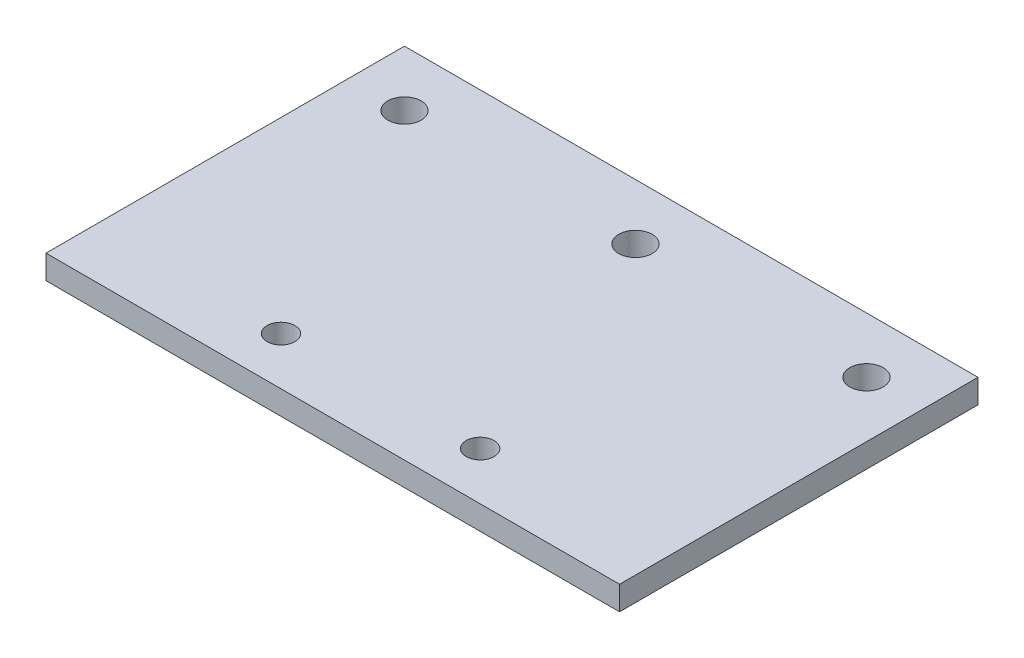
from build123d import *

# Parameters (mm, degrees)
SKETCH1_W           = 72
SKETCH1_H           = 45
SKETCH1_R           = 2.1
SKETCH1_R_2         = 1.75
BOSS_EXTRUDE1_DEPTH = 3
CUT_EXTRUDE2_DEPTH  = 0.5


with BuildPart() as part:
    # Sketch1 → Boss-Extrude1 (new body)
    with BuildSketch(Plane(origin=(0, 0, 0), x_dir=(1, 0, 0), z_dir=(0, 1, 0))):
        with Locations((36, -22.5)):
            Rectangle(SKETCH1_W, SKETCH1_H)
        with Locations((7, -7)):
            Circle(SKETCH1_R, mode=Mode.SUBTRACT)
        with Locations((36, -7)):
            Circle(SKETCH1_R, mode=Mode.SUBTRACT)
        with Locations((65, -7)):
            Circle(SKETCH1_R, mode=Mode.SUBTRACT)
        with Locations((23.5, -39)):
            Circle(SKETCH1_R_2, mode=Mode.SUBTRACT)
        with Locations((48.5, -39)):
            Circle(SKETCH1_R_2, mode=Mode.SUBTRACT)
    extrude(amount=BOSS_EXTRUDE1_DEPTH)

    # Sketch2 → Cut-Extrude2 (cut)
    # profile 1 of 6: a face of its own
    with BuildSketch(Plane.XZ):
        with BuildLine():
            Line((4.423494036, 26.43482906), (4.423494036, 26.244871795))
            Line((4.423494036, 26.244871795), (3.195980013, 26.244871795))
            add(Edge.make_bspline(
                [(3.195980013, 26.244871795), (3.169831563, 26.24503934), (3.119358756, 26.245362741), (3.04637713, 26.247691662), (2.978966688, 26.252602738), (2.916819988, 26.258171798), (2.860225093, 26.266182907), (2.809013126, 26.275965758), (2.763134944, 26.286994002), (2.73487754, 26.296682419), (2.721510863, 26.301265358)],
                knots=[0, 0, 0, 0, 1.307562039, 2.523909702, 3.650326591, 4.686913197, 5.643429486, 6.506965704, 7.293745905, 8, 8, 8, 8], degree=3))
            add(Edge.make_bspline(
                [(2.721510863, 26.301265358), (2.704135496, 26.308031528), (2.669904274, 26.321361564), (2.621390296, 26.346338949), (2.575670537, 26.374264588), (2.533267405, 26.40627237), (2.493513748, 26.441552541), (2.457103748, 26.480752946), (2.42347232, 26.523176569), (2.393284851, 26.569168648), (2.366832646, 26.618263256), (2.343419515, 26.669807439), (2.323198421, 26.723652189), (2.308020893, 26.780315425), (2.294878894, 26.838936442), (2.286324075, 26.900196905), (2.280502177, 26.963741031), (2.279963773, 27.006948461), (2.279690617, 27.028869525)],
                knots=[0, 0, 0, 0, 0.981884813, 1.934411902, 2.870642727, 3.801527012, 4.729816098, 5.667674509, 6.616731011, 7.579249157, 8.562291171, 9.552107921, 10.560574871, 11.588648803, 12.640348669, 13.724070705, 14.845319185, 16, 16, 16, 16], degree=3))
            add(Edge.make_bspline(
                [(2.279690617, 27.028869525), (2.280207439, 27.060852515), (2.281216931, 27.123323889), (2.293020302, 27.214399619), (2.309601389, 27.30078468), (2.334962347, 27.38138587), (2.365868894, 27.455891705), (2.401070851, 27.523967839), (2.441841664, 27.584494611), (2.488089085, 27.639007164), (2.543105256, 27.688196898), (2.607933583, 27.734478461), (2.683569716, 27.779025557), (2.739082386, 27.805132339), (2.768152155, 27.818803419)],
                knots=[0, 0, 0, 0, 1.157931887, 2.261752077, 3.322178827, 4.340878186, 5.316509817, 6.24181319, 7.112369066, 7.954886437, 8.824930176, 9.778504873, 10.836691706, 12, 12, 12, 12], degree=3))
            Line((2.768152155, 27.818803419), (2.768152155, 27.628846154))
            add(Edge.make_bspline(
                [(2.768152155, 27.628846154), (2.74389765, 27.613568532), (2.696483077, 27.583702663), (2.635091788, 27.527853819), (2.582626658, 27.466648089), (2.540347285, 27.398019899), (2.508470411, 27.321683698), (2.485746303, 27.237593559), (2.472141418, 27.145065216), (2.470501731, 27.080647058), (2.469647882, 27.04710203)],
                knots=[0, 0, 0, 0, 0.997731894, 1.950442991, 2.880492273, 3.800895997, 4.748200782, 5.754801363, 6.83083817, 8, 8, 8, 8], degree=3))
            add(Edge.make_bspline(
                [(2.469647882, 27.04710203), (2.470508849, 27.013980238), (2.472168709, 26.95012474), (2.485813508, 26.858179397), (2.508413348, 26.774195538), (2.540173207, 26.698803972), (2.579398849, 26.633143604), (2.622797316, 26.576343526), (2.67190961, 26.530304396), (2.717130879, 26.499330394), (2.757423153, 26.480078352), (2.792107694, 26.467818401), (2.831328282, 26.457855595), (2.874953216, 26.449522067), (2.923044888, 26.442645374), (2.97571324, 26.438289345), (3.03283858, 26.435141068), (3.072446335, 26.434935468), (3.092945158, 26.43482906)],
                knots=[0, 0, 0, 0, 1.570672572, 3.028099501, 4.397683431, 5.686589315, 6.895122698, 8.017723291, 9.066023084, 10.075791025, 10.603605416, 11.180458235, 11.81795017, 12.521450677, 13.286658401, 14.121327423, 15.027701111, 16, 16, 16, 16], degree=3))
            Line((3.092945158, 26.43482906), (3.173083379, 26.43482906))
            add(Edge.make_bspline(
                [(3.173083379, 26.43482906), (3.150137622, 26.454109545), (3.104649718, 26.492331378), (3.045043395, 26.558339523), (2.993707497, 26.630437372), (2.951604799, 26.708502181), (2.917930794, 26.790621737), (2.894379575, 26.87590661), (2.879163826, 26.963592281), (2.877526545, 27.023011439), (2.876699164, 27.053038194)],
                knots=[0, 0, 0, 0, 1.012485704, 2.007162095, 2.997754123, 3.998611389, 4.999708251, 5.992315798, 6.98544096, 8, 8, 8, 8], degree=3))
            add(Edge.make_bspline(
                [(2.876699164, 27.053038194), (2.877010632, 27.070719176), (2.877629883, 27.105871904), (2.883047811, 27.158095966), (2.890908955, 27.209549373), (2.902448682, 27.260112127), (2.917260345, 27.309857189), (2.935776183, 27.358702351), (2.956710085, 27.407043107), (2.981367935, 27.454000732), (3.008801287, 27.499107654), (3.038518773, 27.542023227), (3.070363926, 27.582524191), (3.104654189, 27.620219451), (3.141327356, 27.65508023), (3.180039057, 27.687498571), (3.221093814, 27.717181402), (3.264507607, 27.743744025), (3.309221958, 27.768011612), (3.355451046, 27.788789068), (3.402902409, 27.806037029), (3.450982831, 27.821237785), (3.500569077, 27.832001799), (3.551073449, 27.840232592), (3.602804063, 27.844850599), (3.63765057, 27.845575442), (3.655184741, 27.845940171)],
                knots=[0, 0, 0, 0, 1.028796061, 2.045417375, 3.052978994, 4.056772505, 5.061374657, 6.071351207, 7.095367434, 8.125609542, 9.155490328, 10.16637099, 11.162041966, 12.151987513, 13.129482149, 14.104793677, 15.088808581, 16.075021637, 17.065069715, 18.0481558, 19.021557435, 20.00254184, 20.980451754, 21.971763498, 22.979425854, 24, 24, 24, 24], degree=3))
            add(Edge.make_bspline(
                [(3.655184741, 27.845940171), (3.672724792, 27.845626419), (3.70773696, 27.845000129), (3.759672295, 27.839583657), (3.810918083, 27.831874116), (3.860918314, 27.81960799), (3.910394816, 27.805053392), (3.95854208, 27.786176677), (4.005997289, 27.764428294), (4.05234429, 27.73957093), (4.097156688, 27.711745771), (4.139516677, 27.681117771), (4.179776603, 27.648327207), (4.217420095, 27.61271418), (4.252729303, 27.574489206), (4.285394387, 27.533541168), (4.316005776, 27.490325511), (4.343891623, 27.444694218), (4.368555315, 27.397355209), (4.391060038, 27.34951014), (4.408921158, 27.300525505), (4.424658935, 27.25131449), (4.435807839, 27.201010447), (4.444408909, 27.150230166), (4.449649002, 27.0987998), (4.450303104, 27.064356859), (4.450630788, 27.04710203)],
                knots=[0, 0, 0, 0, 1.008914434, 2.013921196, 3.001938835, 3.98818112, 4.973517748, 5.967241793, 6.960633033, 7.975722852, 8.991170928, 9.993245185, 10.981396684, 11.976616977, 12.972235889, 13.973022409, 14.988340224, 16.01763096, 17.047082309, 18.058647952, 19.057085865, 20.044802253, 21.029198803, 22.0185208, 23.007341325, 24, 24, 24, 24], degree=3))
            add(Edge.make_bspline(
                [(4.450630788, 27.04710203), (4.449823108, 27.018645117), (4.448232158, 26.962591299), (4.435361307, 26.879935529), (4.415300669, 26.800090162), (4.386138751, 26.722646176), (4.346674616, 26.647130861), (4.294024708, 26.573998697), (4.229229, 26.501997715), (4.179039947, 26.457788746), (4.152974538, 26.43482906)],
                knots=[0, 0, 0, 0, 0.967343326, 1.905452219, 2.838102277, 3.762990896, 4.713322225, 5.726933809, 6.819495538, 8, 8, 8, 8], degree=3))
            Line((4.152974538, 26.43482906), (4.423494036, 26.43482906))
        make_face()
        with BuildLine():
            add(Edge.make_bspline(
                [(4.260673523, 27.031837607), (4.259729458, 27.059614759), (4.257860411, 27.114607629), (4.24190382, 27.195215169), (4.216899853, 27.273034726), (4.181130914, 27.346574594), (4.137537484, 27.415470369), (4.084693971, 27.476563367), (4.024517712, 27.530098824), (3.956981813, 27.574824031), (3.884453534, 27.610761637), (3.808102585, 27.636889221), (3.728808707, 27.653214814), (3.674766665, 27.655055823), (3.647552529, 27.655982906)],
                knots=[0, 0, 0, 0, 1.026331696, 2.03191913, 3.02692423, 4.041490544, 5.047661868, 6.033509946, 7.018359977, 8.017132933, 9.01989117, 10.003339456, 10.994534818, 12, 12, 12, 12], degree=3))
            add(Edge.make_bspline(
                [(3.647552529, 27.655982906), (3.627030855, 27.655544196), (3.586670724, 27.654681382), (3.527443377, 27.64637903), (3.47102458, 27.632975232), (3.417448646, 27.6139257), (3.366202273, 27.590476699), (3.318232977, 27.560273564), (3.272660616, 27.525512831), (3.230421767, 27.485640303), (3.191893907, 27.441771648), (3.158217236, 27.394220074), (3.130295068, 27.343246005), (3.106520921, 27.28966394), (3.089031591, 27.232339481), (3.07571021, 27.172132208), (3.068083023, 27.108638276), (3.067138165, 27.065354269), (3.066656429, 27.043285924)],
                knots=[0, 0, 0, 0, 1.039892369, 2.045164194, 3.025377528, 3.974939947, 4.923826224, 5.876304068, 6.842270891, 7.825700405, 8.815919897, 9.798017152, 10.773083594, 11.758208475, 12.764450271, 13.80592145, 14.881349344, 16, 16, 16, 16], degree=3))
            add(Edge.make_bspline(
                [(3.066656429, 27.043285924), (3.06712065, 27.020931651), (3.068028428, 26.977218107), (3.075831973, 26.913372829), (3.088424309, 26.852876832), (3.10630291, 26.795785623), (3.129115553, 26.741883512), (3.157984968, 26.691776495), (3.19086203, 26.644388392), (3.229212979, 26.601238898), (3.271470152, 26.562201738), (3.317483561, 26.528252265), (3.366365202, 26.499095046), (3.41873829, 26.475888849), (3.47391075, 26.456746469), (3.5328129, 26.444678359), (3.594577806, 26.436023084), (3.636919542, 26.435233118), (3.658576835, 26.43482906)],
                knots=[0, 0, 0, 0, 1.121992135, 2.194043731, 3.223932285, 4.220423016, 5.193184374, 6.156086365, 7.118779155, 8.084057622, 9.048292205, 10.002025119, 10.950065319, 11.899697616, 12.87359713, 13.875731462, 14.913461982, 16, 16, 16, 16], degree=3))
            add(Edge.make_bspline(
                [(3.658576835, 26.43482906), (3.686769537, 26.435639179), (3.741848171, 26.437221869), (3.822104163, 26.452157771), (3.897559526, 26.47623951), (3.967975487, 26.510013524), (4.032606422, 26.552335882), (4.090253534, 26.603312126), (4.140997801, 26.662061024), (4.183253261, 26.728421865), (4.217520616, 26.799914417), (4.242890164, 26.874690228), (4.257595363, 26.952538428), (4.259639756, 27.005205832), (4.260673523, 27.031837607)],
                knots=[0, 0, 0, 0, 1.070930318, 2.092221514, 3.091405799, 4.074392322, 5.052047932, 6.019043127, 6.99061078, 7.993717296, 9.000730765, 9.998165278, 10.987753177, 12, 12, 12, 12], degree=3))
        make_face(mode=Mode.SUBTRACT)
    # profile 2 of 6: a face of its own
    with BuildSketch(Plane.XZ):
        with BuildLine():
            Line((4.423494036, 25.864957265), (4.423494036, 25.675))
            Line((4.423494036, 25.675), (4.195799725, 25.675))
            add(Edge.make_bspline(
                [(4.195799725, 25.675), (4.217002372, 25.660978007), (4.257552271, 25.634161054), (4.311147307, 25.589560422), (4.355720437, 25.543889685), (4.390836421, 25.496580868), (4.417350585, 25.448029456), (4.436934526, 25.399042786), (4.448318183, 25.348606082), (4.449858887, 25.314644483), (4.450630788, 25.297629541)],
                knots=[0, 0, 0, 0, 1.280622107, 2.44917983, 3.507334186, 4.490567186, 5.408878616, 6.288712897, 7.142636019, 8, 8, 8, 8], degree=3))
            add(Edge.make_bspline(
                [(4.450630788, 25.297629541), (4.44992691, 25.284425533), (4.448485966, 25.257394953), (4.43785522, 25.216352112), (4.421526665, 25.173891045), (4.405795891, 25.146490071), (4.397629319, 25.132264957)],
                knots=[0, 0, 0, 0, 0.90119973, 1.844890732, 2.881183062, 4, 4, 4, 4], degree=3))
            Line((4.397629319, 25.132264957), (4.233112759, 25.236571848))
            add(Edge.make_bspline(
                [(4.233112759, 25.236571848), (4.237189015, 25.245709209), (4.24492653, 25.263053668), (4.254083841, 25.288426191), (4.259475847, 25.31181919), (4.260292709, 25.326722676), (4.260673523, 25.33367054)],
                knots=[0, 0, 0, 0, 1.180555205, 2.24091978, 3.179933427, 4, 4, 4, 4], degree=3))
            add(Edge.make_bspline(
                [(4.260673523, 25.33367054), (4.259694858, 25.349067185), (4.257716496, 25.380191374), (4.241055141, 25.425820811), (4.215267885, 25.47029855), (4.185650966, 25.505172121), (4.157638478, 25.532381074), (4.133042781, 25.551808381), (4.105482287, 25.569641234), (4.075406583, 25.586676692), (4.042308374, 25.602198928), (4.00651653, 25.61668573), (3.967990121, 25.629784205), (3.94114926, 25.63725316), (3.927400286, 25.64107906)],
                knots=[0, 0, 0, 0, 1.135927944, 2.296268816, 3.551388088, 4.924624343, 5.663947748, 6.437790805, 7.238014523, 8.089896346, 8.992356783, 9.939655789, 10.944608424, 12, 12, 12, 12], degree=3))
            add(Edge.make_bspline(
                [(3.927400286, 25.64107906), (3.915137424, 25.643941031), (3.887976116, 25.65028008), (3.842408199, 25.656443534), (3.788570081, 25.662533195), (3.726311904, 25.666824959), (3.65578914, 25.670803108), (3.576894354, 25.673046825), (3.489546565, 25.674923486), (3.428481123, 25.674973722), (3.396537572, 25.675)],
                knots=[0, 0, 0, 0, 0.566838948, 1.255505196, 2.06880316, 3.007127437, 4.065329342, 5.249902469, 6.561414163, 8, 8, 8, 8], degree=3))
            Line((3.396537572, 25.675), (2.876699164, 25.675))
            Line((2.876699164, 25.675), (2.876699164, 25.864957265))
            Line((2.876699164, 25.864957265), (4.423494036, 25.864957265))
        make_face()
    # profile 3 of 6: a face of its own
    with BuildSketch(Plane.XZ):
        with BuildLine():
            add(Edge.make_bspline(
                [(4.450630788, 24.168062233), (4.450014601, 24.139038219), (4.448806408, 24.08212922), (4.435829771, 23.998798463), (4.416151529, 23.919336542), (4.388451844, 23.84340259), (4.352108775, 23.771624734), (4.30815919, 23.703362115), (4.256305745, 23.638751501), (4.216171534, 23.600034427), (4.195799725, 23.580381944)],
                knots=[0, 0, 0, 0, 1.054042676, 2.066720093, 3.05716247, 4.025731183, 4.997454851, 5.974904663, 6.97207755, 8, 8, 8, 8], degree=3))
            add(Edge.make_bspline(
                [(4.195799725, 23.580381944), (4.176317933, 23.563459525), (4.137731377, 23.52994218), (4.075165363, 23.486964341), (4.010371112, 23.449939874), (3.942488205, 23.420268464), (3.872109237, 23.396873235), (3.798992307, 23.380263028), (3.723298887, 23.370383073), (3.671891804, 23.369050802), (3.645856482, 23.368376068)],
                knots=[0, 0, 0, 0, 1.025258237, 2.030674902, 3.01204498, 3.988269485, 4.97094183, 5.956517959, 6.965070386, 8, 8, 8, 8], degree=3))
            add(Edge.make_bspline(
                [(3.645856482, 23.368376068), (3.619670257, 23.368969544), (3.567925054, 23.370142279), (3.491713343, 23.3812358), (3.417814567, 23.398490312), (3.346538127, 23.423183856), (3.277666101, 23.454848032), (3.21149949, 23.493486739), (3.147907038, 23.5393708), (3.087431471, 23.591383527), (3.031686383, 23.64886435), (2.983130344, 23.711235681), (2.941355497, 23.777317034), (2.908174654, 23.848010484), (2.881428583, 23.922309733), (2.862985445, 24.000687371), (2.851734631, 24.083073478), (2.85029667, 24.139334149), (2.849562412, 24.168062233)],
                knots=[0, 0, 0, 0, 0.998669827, 1.973418153, 2.932281609, 3.89081133, 4.846438734, 5.82045571, 6.809776312, 7.834649874, 8.860672198, 9.859676908, 10.845817165, 11.837296335, 12.833502054, 13.853824644, 14.904110009, 16, 16, 16, 16], degree=3))
            add(Edge.make_bspline(
                [(2.849562412, 24.168062233), (2.850302745, 24.196929686), (2.851752726, 24.253468052), (2.862901755, 24.336164376), (2.88162564, 24.414872008), (2.907843543, 24.48952271), (2.941628034, 24.560215874), (2.982967802, 24.626541233), (3.031710971, 24.688941984), (3.087424809, 24.746440828), (3.147908754, 24.798448723), (3.211499045, 24.844334031), (3.277666217, 24.882972413), (3.346538096, 24.914636674), (3.417814576, 24.939330196), (3.491713341, 24.956584715), (3.567925055, 24.967678234), (3.619670257, 24.968850969), (3.645856482, 24.969444444)],
                knots=[0, 0, 0, 0, 1.099861214, 2.154133753, 3.1731438, 4.178222029, 5.163564916, 6.153006591, 7.15072618, 8.175428628, 9.198983792, 10.187031731, 11.15979573, 12.114193814, 13.071490482, 14.029120454, 15.002614863, 16, 16, 16, 16], degree=3))
            add(Edge.make_bspline(
                [(3.645856482, 24.969444444), (3.671750298, 24.968765109), (3.723015603, 24.967420142), (3.798566731, 24.95755012), (3.871559914, 24.941004707), (3.941667225, 24.917581434), (4.009252656, 24.887636533), (4.074207006, 24.851132325), (4.136490104, 24.807716086), (4.175026791, 24.774332048), (4.19452769, 24.757438568)],
                knots=[0, 0, 0, 0, 1.031353054, 2.041901799, 3.029428768, 4.008703097, 4.981709435, 5.96992636, 6.972712378, 8, 8, 8, 8], degree=3))
            add(Edge.make_bspline(
                [(4.19452769, 24.757438568), (4.215072737, 24.737814088), (4.255478187, 24.699219095), (4.307229322, 24.634310229), (4.351771454, 24.566341252), (4.388096233, 24.494100404), (4.41610127, 24.417955312), (4.435921615, 24.337902814), (4.448749009, 24.25426875), (4.449997277, 24.197084113), (4.450630788, 24.168062233)],
                knots=[0, 0, 0, 0, 1.027951202, 2.021646915, 2.998468564, 3.9668038, 4.943370589, 5.93035926, 6.949632805, 8, 8, 8, 8], degree=3))
        make_face()
        with BuildLine():
            add(Edge.make_bspline(
                [(4.260673523, 24.168910256), (4.260090143, 24.189434408), (4.258938443, 24.229952883), (4.250179585, 24.289594583), (4.236300125, 24.347009542), (4.216588639, 24.402314015), (4.191105406, 24.455294104), (4.159982092, 24.506008101), (4.123052932, 24.554319758), (4.081051926, 24.599857935), (4.035431468, 24.642141314), (3.986375539, 24.678677482), (3.935291457, 24.709802227), (3.881914058, 24.735703799), (3.825737833, 24.755001808), (3.767389598, 24.769015492), (3.706753008, 24.777766671), (3.665531805, 24.778907464), (3.644584447, 24.779487179)],
                knots=[0, 0, 0, 0, 1.021589593, 2.016807015, 2.994807536, 3.958602519, 4.934347097, 5.916793557, 6.916107818, 7.957073844, 8.998039869, 10.008589932, 10.997041759, 11.972786337, 12.956492182, 13.948170289, 14.957322718, 16, 16, 16, 16], degree=3))
            add(Edge.make_bspline(
                [(3.644584447, 24.779487179), (3.61751893, 24.778517998), (3.563798939, 24.776594354), (3.484706943, 24.760872004), (3.408633657, 24.734756449), (3.336495025, 24.698744847), (3.269634043, 24.654395477), (3.209512333, 24.602537983), (3.158448429, 24.54245542), (3.115502826, 24.476193712), (3.081683204, 24.404691873), (3.057430037, 24.329148661), (3.041876275, 24.250251921), (3.040312084, 24.196261441), (3.039519677, 24.168910256)],
                knots=[0, 0, 0, 0, 1.016977094, 2.018509362, 3.018404954, 4.033172147, 5.041280572, 6.028085189, 7.007940189, 7.995502847, 8.989109012, 9.972200833, 10.97273166, 12, 12, 12, 12], degree=3))
            add(Edge.make_bspline(
                [(3.039519677, 24.168910256), (3.040307494, 24.141557498), (3.041862624, 24.087563913), (3.057508838, 24.008557398), (3.081577742, 23.932807147), (3.115541023, 23.861230964), (3.158286106, 23.794939081), (3.209803239, 23.735285548), (3.269475994, 23.682981464), (3.336406372, 23.63858818), (3.408745805, 23.603156825), (3.484692926, 23.576918456), (3.563802509, 23.561233813), (3.617520126, 23.559305079), (3.644584447, 23.558333333)],
                knots=[0, 0, 0, 0, 1.027082318, 2.027431966, 3.015401697, 4.008827937, 4.996211763, 5.971861488, 6.96198607, 7.969911943, 8.982141629, 9.981856156, 10.983207064, 12, 12, 12, 12], degree=3))
            add(Edge.make_bspline(
                [(3.644584447, 23.558333333), (3.665533478, 23.558908736), (3.706757972, 23.56004104), (3.767370622, 23.568853957), (3.825853238, 23.582649953), (3.881687672, 23.602793026), (3.935552156, 23.627805641), (3.986222142, 23.659687532), (4.035462654, 23.696053522), (4.081024429, 23.73841449), (4.123206394, 23.783947541), (4.159847568, 23.832622141), (4.19112318, 23.883359691), (4.216591777, 23.936356523), (4.236224255, 23.991535845), (4.250240046, 24.048776488), (4.258906508, 24.108154067), (4.260080751, 24.148528664), (4.260673523, 24.168910256)],
                knots=[0, 0, 0, 0, 1.043020522, 2.052505155, 3.044509714, 4.030878336, 5.003918577, 5.996372628, 7.007255355, 8.048564058, 9.08987276, 10.095126797, 11.077896669, 12.053962454, 13.01807471, 13.98956039, 14.985105429, 16, 16, 16, 16], degree=3))
        make_face(mode=Mode.SUBTRACT)
    # profile 4 of 6: a face of its own
    with BuildSketch(Plane.XZ):
        with BuildLine():
            Line((4.423494036, 23.015598291), (4.423494036, 22.825641026))
            Line((4.423494036, 22.825641026), (3.706066151, 22.825641026))
            add(Edge.make_bspline(
                [(3.706066151, 22.825641026), (3.685006679, 22.825555207), (3.644720895, 22.82539104), (3.58675133, 22.824277709), (3.533885032, 22.821659033), (3.486091463, 22.818384958), (3.443378707, 22.814174524), (3.405895953, 22.809165063), (3.373218137, 22.803565922), (3.353537155, 22.798085138), (3.344384127, 22.795536191)],
                knots=[0, 0, 0, 0, 1.388932606, 2.656963016, 3.823490214, 4.879454478, 5.816252168, 6.653371382, 7.373723809, 8, 8, 8, 8], degree=3))
            add(Edge.make_bspline(
                [(3.344384127, 22.795536191), (3.332879851, 22.791447094), (3.310110471, 22.783353911), (3.277217607, 22.768674623), (3.246754288, 22.750513178), (3.217535392, 22.730646191), (3.190465168, 22.707705721), (3.16536681, 22.682027198), (3.141947537, 22.654066412), (3.11370202, 22.613109395), (3.08381043, 22.557120646), (3.057659027, 22.483777144), (3.042259735, 22.404107312), (3.040449911, 22.348978666), (3.039519677, 22.320643029)],
                knots=[0, 0, 0, 0, 0.725930277, 1.436768641, 2.137297926, 2.832005607, 3.535753883, 4.242956221, 4.964984144, 5.701683124, 7.198126434, 8.723945959, 10.316137162, 12, 12, 12, 12], degree=3))
            add(Edge.make_bspline(
                [(3.039519677, 22.320643029), (3.040446436, 22.292303801), (3.042235001, 22.237611576), (3.057426528, 22.158774177), (3.082210251, 22.086574605), (3.117290686, 22.021855856), (3.160058292, 21.965024207), (3.210262551, 21.917669872), (3.266292424, 21.87859756), (3.308096282, 21.861537618), (3.329119703, 21.852958066)],
                knots=[0, 0, 0, 0, 1.157091467, 2.233085092, 3.266839029, 4.264239195, 5.228693433, 6.160074799, 7.074690074, 8, 8, 8, 8], degree=3))
            add(Edge.make_bspline(
                [(3.329119703, 21.852958066), (3.337565809, 21.850419679), (3.356238087, 21.844807926), (3.387919055, 21.83882168), (3.425663015, 21.833205974), (3.469866343, 21.82946204), (3.520139239, 21.825189059), (3.576741685, 21.823713588), (3.639340045, 21.821606539), (3.68316688, 21.821589894), (3.706066151, 21.821581197)],
                knots=[0, 0, 0, 0, 0.557560243, 1.232629526, 2.036798082, 2.970922211, 4.03790722, 5.227863888, 6.551574656, 8, 8, 8, 8], degree=3))
            Line((3.706066151, 21.821581197), (4.423494036, 21.821581197))
            Line((4.423494036, 21.821581197), (4.423494036, 21.631623932))
            Line((4.423494036, 21.631623932), (3.670449164, 21.631623932))
            add(Edge.make_bspline(
                [(3.670449164, 21.631623932), (3.644863398, 21.631891051), (3.595223512, 21.6324093), (3.523085032, 21.63573994), (3.455858318, 21.641454675), (3.393507914, 21.650128686), (3.336080991, 21.660328063), (3.28350538, 21.673486557), (3.235938311, 21.689193441), (3.192561081, 21.706928954), (3.153190353, 21.727823028), (3.116045054, 21.750210879), (3.081187023, 21.775336634), (3.048444923, 21.802977767), (3.017937515, 21.833010131), (2.989797796, 21.865634372), (2.963527777, 21.900196099), (2.939641453, 21.937297839), (2.918349132, 21.976977482), (2.899784991, 22.019035386), (2.884449042, 22.063778351), (2.871909102, 22.110705158), (2.861525499, 22.160208505), (2.854565275, 22.212074941), (2.850134681, 22.266432862), (2.849756371, 22.303390749), (2.849562412, 22.322339076)],
                knots=[0, 0, 0, 0, 1.492959813, 2.896546261, 4.212934643, 5.4282803, 6.568701279, 7.614836728, 8.587629399, 9.489753423, 10.345563548, 11.185732697, 12.018869657, 12.849922188, 13.68387515, 14.5140269, 15.361852057, 16.215154979, 17.085973896, 17.987004002, 18.894652782, 19.842944701, 20.819888734, 21.843945232, 22.894589698, 24, 24, 24, 24], degree=3))
            add(Edge.make_bspline(
                [(2.849562412, 22.322339076), (2.849767854, 22.341145063), (2.850171566, 22.378100578), (2.85449066, 22.432330331), (2.861631791, 22.484308774), (2.871825185, 22.53385111), (2.884548813, 22.581007055), (2.899669998, 22.625967619), (2.91846629, 22.668206345), (2.939619384, 22.7082307), (2.963546955, 22.745727382), (2.989774294, 22.780869237), (3.018262246, 22.813609143), (3.048891838, 22.843954322), (3.082043033, 22.871478836), (3.117449158, 22.896525681), (3.154759392, 22.91948045), (3.194711876, 22.940255709), (3.238600663, 22.958103294), (3.287161288, 22.973860515), (3.340926144, 22.986748377), (3.399849262, 22.997236441), (3.463648645, 23.005673741), (3.532693353, 23.011531551), (3.606815205, 23.014806839), (3.658008234, 23.015328785), (3.684441552, 23.015598291)],
                knots=[0, 0, 0, 0, 1.083640291, 2.129454052, 3.13281866, 4.105697902, 5.042300162, 5.946461698, 6.836384745, 7.703652036, 8.553297018, 9.397182691, 10.228592656, 11.052265423, 11.879314572, 12.708807002, 13.549817954, 14.402308542, 15.300838682, 16.27712199, 17.341985831, 18.484375296, 19.725102775, 21.0496083, 22.476576903, 24, 24, 24, 24], degree=3))
            Line((3.684441552, 23.015598291), (4.423494036, 23.015598291))
        make_face()
    # profile 5 of 6: a face of its own
    with BuildSketch(Plane.XZ):
        with BuildLine():
            Line((4.423494036, 21.197435897), (4.423494036, 21.007478632))
            Line((4.423494036, 21.007478632), (4.137286103, 21.007478632))
            add(Edge.make_bspline(
                [(4.137286103, 21.007478632), (4.163246735, 20.987300267), (4.213696028, 20.94808765), (4.279172089, 20.88050889), (4.333984734, 20.808840382), (4.377177883, 20.731999996), (4.409909915, 20.650913484), (4.43386268, 20.565663002), (4.44805804, 20.47553697), (4.449761859, 20.413912915), (4.450630788, 20.38248531)],
                knots=[0, 0, 0, 0, 1.082960489, 2.104516986, 3.092433479, 4.050182639, 5.001196938, 5.969027827, 6.964226023, 8, 8, 8, 8], degree=3))
            add(Edge.make_bspline(
                [(4.450630788, 20.38248531), (4.449836627, 20.355034197), (4.448266927, 20.300775632), (4.437639413, 20.220908822), (4.41942538, 20.143997995), (4.39317816, 20.070478267), (4.360729376, 19.999562032), (4.319776692, 19.932299143), (4.272359615, 19.867641898), (4.217790648, 19.807216393), (4.158748791, 19.751383947), (4.095235303, 19.703096018), (4.029338881, 19.661444914), (3.960037949, 19.627777639), (3.887878225, 19.601404972), (3.812568168, 19.582648477), (3.734387004, 19.571485997), (3.681226787, 19.569988333), (3.654336717, 19.569230769)],
                knots=[0, 0, 0, 0, 1.041296284, 2.058176809, 3.050446431, 4.034000596, 5.01514041, 6.003636468, 7.015969324, 8.052561599, 9.08815499, 10.094063707, 11.074456064, 12.040834395, 13.011057502, 13.983766392, 14.980127149, 16, 16, 16, 16], degree=3))
            add(Edge.make_bspline(
                [(3.654336717, 19.569230769), (3.62687756, 19.569967776), (3.572724138, 19.571421261), (3.493228305, 19.582816671), (3.416604228, 19.600726878), (3.343581124, 19.627572871), (3.273102471, 19.660441443), (3.206359366, 19.701567099), (3.142715529, 19.749820865), (3.083244545, 19.805053339), (3.028444831, 19.864949383), (2.980549432, 19.928992108), (2.940153573, 19.996225971), (2.906881715, 20.066329584), (2.881237956, 20.139547869), (2.863084271, 20.215841345), (2.851790377, 20.295226547), (2.850310762, 20.349233746), (2.849562412, 20.376549145)],
                knots=[0, 0, 0, 0, 1.038787011, 2.048637893, 3.033314735, 4.011256821, 4.987456671, 5.971770257, 6.972013799, 8.005388554, 9.039095487, 10.040396776, 11.026510796, 12.002710647, 12.972028308, 13.95670515, 14.966556032, 16, 16, 16, 16], degree=3))
            add(Edge.make_bspline(
                [(2.849562412, 20.376549145), (2.850322121, 20.40743331), (2.851815946, 20.468161233), (2.867716215, 20.557025255), (2.890780138, 20.642445664), (2.925552836, 20.723520094), (2.968672647, 20.801228726), (3.022590274, 20.874339144), (3.084731877, 20.944482728), (3.132592593, 20.986219557), (3.156970932, 21.007478632)],
                knots=[0, 0, 0, 0, 1.019281043, 2.00422519, 2.974076634, 3.936751752, 4.91100001, 5.903882226, 6.932321223, 8, 8, 8, 8], degree=3))
            Line((3.156970932, 21.007478632), (2.306827369, 21.007478632))
            Line((2.306827369, 21.007478632), (2.306827369, 21.197435897))
            Line((2.306827369, 21.197435897), (4.423494036, 21.197435897))
        make_face()
        with BuildLine():
            add(Edge.make_bspline(
                [(4.260673523, 20.384181357), (4.260285742, 20.405698234), (4.259522303, 20.44805942), (4.25047487, 20.51015576), (4.237298503, 20.569948944), (4.217547494, 20.626803418), (4.192727296, 20.681181817), (4.162737895, 20.733178487), (4.126231902, 20.781918995), (4.085333994, 20.827980808), (4.040495089, 20.870061772), (3.992202909, 20.906895068), (3.941122444, 20.937887764), (3.887519364, 20.963584874), (3.831008785, 20.983146606), (3.771903151, 20.997028871), (3.710140319, 21.00575593), (3.66807548, 21.006898269), (3.646704506, 21.007478632)],
                knots=[0, 0, 0, 0, 1.056783697, 2.080534709, 3.078213817, 4.062450963, 5.032388505, 6.013014931, 7.006476528, 8.020136409, 9.037574406, 10.02408906, 10.99988041, 11.969394914, 12.94050107, 13.932990591, 14.949859205, 16, 16, 16, 16], degree=3))
            add(Edge.make_bspline(
                [(3.646704506, 21.007478632), (3.618655024, 21.006504002), (3.563703712, 21.004594618), (3.483296069, 20.989440869), (3.40749148, 20.96382124), (3.336330527, 20.928610142), (3.271215599, 20.883793978), (3.212440967, 20.830388888), (3.161329288, 20.767787577), (3.118106937, 20.697627279), (3.083045996, 20.622372605), (3.057937675, 20.543885368), (3.042473112, 20.463230762), (3.040509486, 20.408700479), (3.039519677, 20.381213275)],
                knots=[0, 0, 0, 0, 1.037446521, 2.0324456, 3.014856775, 3.990198243, 4.96070402, 5.930645943, 6.919052903, 7.940784962, 8.972706292, 9.9832942, 10.983434506, 12, 12, 12, 12], degree=3))
            add(Edge.make_bspline(
                [(3.039519677, 20.381213275), (3.040460922, 20.35427975), (3.042329124, 20.300821544), (3.058499248, 20.222106711), (3.083201198, 20.145610603), (3.119218894, 20.072927887), (3.163366696, 20.00470525), (3.216296761, 19.943058962), (3.277820008, 19.889299971), (3.345908042, 19.842923515), (3.419241681, 19.805886463), (3.49523256, 19.778744874), (3.573235073, 19.76256706), (3.625855021, 19.76031585), (3.652216659, 19.759188034)],
                knots=[0, 0, 0, 0, 1.000942316, 1.986690553, 2.977613063, 3.984008645, 4.994597959, 5.993715906, 6.995776077, 8.025307715, 9.050480445, 10.043228463, 11.019692995, 12, 12, 12, 12], degree=3))
            add(Edge.make_bspline(
                [(3.652216659, 19.759188034), (3.67873678, 19.760070955), (3.731570404, 19.761829917), (3.809466748, 19.779047034), (3.885439622, 19.80515281), (3.958118754, 19.842279444), (4.025913839, 19.887823013), (4.086291462, 19.941975028), (4.138979156, 20.002870724), (4.182539392, 20.071008169), (4.217181304, 20.144151748), (4.242511511, 20.22114605), (4.257735481, 20.301605994), (4.259685561, 20.356414114), (4.260673523, 20.384181357)],
                knots=[0, 0, 0, 0, 0.983883291, 1.96010114, 2.949781603, 3.961842304, 4.982704228, 5.97556912, 6.965945748, 7.965066277, 8.970293822, 9.964878779, 10.968953791, 12, 12, 12, 12], degree=3))
        make_face(mode=Mode.SUBTRACT)
    # profile 6 of 6: a face of its own
    with BuildSketch(Plane.XZ):
        with BuildLine():
            Line((4.504904292, 18.239529915), (4.504904292, 18.429487179))
            add(Edge.make_bspline(
                [(4.504904292, 18.429487179), (4.526211556, 18.424340927), (4.567865515, 18.414280426), (4.627378477, 18.393296655), (4.683696036, 18.370437105), (4.735763661, 18.342987504), (4.784627759, 18.313046495), (4.829180039, 18.278742754), (4.870553595, 18.241658922), (4.907270648, 18.200640977), (4.940519084, 18.157625072), (4.968867333, 18.112005087), (4.993253845, 18.064698861), (5.013344175, 18.015378633), (5.028478659, 17.963897567), (5.039459203, 17.910721081), (5.04659002, 17.855709821), (5.047285957, 17.818367231), (5.047639335, 17.799405716)],
                knots=[0, 0, 0, 0, 1.162005537, 2.271625781, 3.343758855, 4.383309926, 5.390229558, 6.379919256, 7.361854164, 8.333198761, 9.295911338, 10.242430842, 11.177959212, 12.116337295, 13.062827104, 14.020064771, 14.994644689, 16, 16, 16, 16], degree=3))
            add(Edge.make_bspline(
                [(5.047639335, 17.799405716), (5.046805229, 17.771778534), (5.045155211, 17.717126799), (5.030087909, 17.636836765), (5.006245091, 17.559411022), (4.973301456, 17.485697049), (4.932669129, 17.417226854), (4.884309502, 17.356305446), (4.829155639, 17.303758584), (4.768236421, 17.259674842), (4.703130471, 17.225158056), (4.636122756, 17.199705821), (4.567372231, 17.184210804), (4.520952353, 17.182202658), (4.497696092, 17.181196581)],
                knots=[0, 0, 0, 0, 1.083050992, 2.142477498, 3.193116406, 4.255571735, 5.30263384, 6.308962982, 7.297363603, 8.282367274, 9.249857812, 10.179914175, 11.08814088, 12, 12, 12, 12], degree=3))
            add(Edge.make_bspline(
                [(4.497696092, 17.181196581), (4.475315793, 17.181900277), (4.431521019, 17.1832773), (4.367584685, 17.194969588), (4.307325241, 17.214646281), (4.250489015, 17.241902756), (4.197436374, 17.277185503), (4.148047954, 17.319925658), (4.102104701, 17.370424887), (4.075785782, 17.408693578), (4.062236023, 17.428395433)],
                knots=[0, 0, 0, 0, 1.024540389, 2.004866551, 2.965041327, 3.920577974, 4.882998113, 5.874504559, 6.905732034, 8, 8, 8, 8], degree=3))
            add(Edge.make_bspline(
                [(4.062236023, 17.428395433), (4.05136351, 17.405879086), (4.029821916, 17.36126769), (3.987575815, 17.300458561), (3.938797929, 17.245257179), (3.90073261, 17.214472549), (3.881607017, 17.199005075)],
                knots=[0, 0, 0, 0, 1.015518401, 2.012035669, 3.001164323, 4, 4, 4, 4], degree=3))
            add(Edge.make_bspline(
                [(3.881607017, 17.199005075), (3.867664053, 17.188815927), (3.840006451, 17.168604485), (3.795512711, 17.143727374), (3.750673105, 17.120900948), (3.703724595, 17.104101359), (3.656175253, 17.089603979), (3.607006855, 17.080065187), (3.556686544, 17.073941663), (3.522628346, 17.073081795), (3.505508592, 17.072649573)],
                knots=[0, 0, 0, 0, 1.02516404, 2.033540309, 3.025129118, 4.011046665, 4.991655828, 5.976607087, 6.982917762, 8, 8, 8, 8], degree=3))
            add(Edge.make_bspline(
                [(3.505508592, 17.072649573), (3.475870559, 17.073737216), (3.416733968, 17.075907384), (3.329343482, 17.095226383), (3.244065558, 17.125348814), (3.16216374, 17.167377268), (3.085693667, 17.219377506), (3.017584153, 17.281585133), (2.958644715, 17.352487893), (2.909558218, 17.43162174), (2.870291139, 17.517319335), (2.843044071, 17.608988527), (2.825296195, 17.705296335), (2.823393162, 17.771340825), (2.82242566, 17.804917869)],
                knots=[0, 0, 0, 0, 0.95570045, 1.906903359, 2.87519758, 3.868912786, 4.869932978, 5.851730567, 6.836639976, 7.83677598, 8.849487602, 9.869908895, 10.917060885, 12, 12, 12, 12], degree=3))
            add(Edge.make_bspline(
                [(2.82242566, 17.804917869), (2.822950722, 17.827547636), (2.82398387, 17.872075472), (2.831046643, 17.937537016), (2.843946217, 18.000022044), (2.861304883, 18.059615039), (2.883313222, 18.116368942), (2.910720244, 18.170110567), (2.94296101, 18.22117055), (2.980416084, 18.269067059), (3.022314799, 18.313794383), (3.069400962, 18.354163888), (3.120804154, 18.39084862), (3.177121431, 18.422866311), (3.237624992, 18.451675325), (3.30308956, 18.475370475), (3.372929897, 18.496226033), (3.421599768, 18.505922462), (3.446570959, 18.510897436)],
                knots=[0, 0, 0, 0, 1.048658725, 2.063410685, 3.046034179, 4.001477787, 4.936774919, 5.862367409, 6.792675028, 7.730719943, 8.675894397, 9.627829632, 10.600096036, 11.597688215, 12.626045268, 13.701542398, 14.82072376, 16, 16, 16, 16], degree=3))
            Line((3.446570959, 18.510897436), (3.446570959, 18.320940171))
            add(Edge.make_bspline(
                [(3.446570959, 18.320940171), (3.430273222, 18.315991228), (3.398572709, 18.306365104), (3.352949286, 18.289979505), (3.31112513, 18.27131155), (3.272793432, 18.251285126), (3.237576694, 18.230252447), (3.206406135, 18.206718183), (3.177912655, 18.182425414), (3.161859485, 18.164113615), (3.15400285, 18.155151576)],
                knots=[0, 0, 0, 0, 1.198163088, 2.33053128, 3.407730985, 4.417276592, 5.372219308, 6.28897303, 7.162600585, 8, 8, 8, 8], degree=3))
            add(Edge.make_bspline(
                [(3.15400285, 18.155151576), (3.144865905, 18.143300313), (3.126620219, 18.119634369), (3.103335901, 18.081069772), (3.083160424, 18.040511484), (3.067748855, 17.997080705), (3.054699508, 17.951714629), (3.046159956, 17.903679985), (3.040300919, 17.853400553), (3.039783889, 17.819069573), (3.039519677, 17.801525775)],
                knots=[0, 0, 0, 0, 0.946170439, 1.889420265, 2.845303464, 3.807233317, 4.801018734, 5.828864929, 6.890507805, 8, 8, 8, 8], degree=3))
            add(Edge.make_bspline(
                [(3.039519677, 17.801525775), (3.039891547, 17.781717436), (3.040618707, 17.742983939), (3.047325336, 17.686469747), (3.057050157, 17.632688524), (3.072261667, 17.58218911), (3.090510386, 17.53428433), (3.114401309, 17.490043558), (3.141382244, 17.44816617), (3.172766261, 17.409878979), (3.206688986, 17.375361204), (3.242677974, 17.345534033), (3.279617332, 17.319700291), (3.318368781, 17.298934274), (3.3585522, 17.28250738), (3.400317997, 17.271331387), (3.443314476, 17.263558763), (3.472542055, 17.262925882), (3.487276087, 17.262606838)],
                knots=[0, 0, 0, 0, 1.216990249, 2.379719373, 3.493992396, 4.571561497, 5.616923107, 6.638958652, 7.655775068, 8.674704564, 9.676001865, 10.625896028, 11.54399481, 12.441854662, 13.322657739, 14.20572845, 15.095482574, 16, 16, 16, 16], degree=3))
            add(Edge.make_bspline(
                [(3.487276087, 17.262606838), (3.506998205, 17.263532289), (3.546344306, 17.265378588), (3.604230314, 17.279474975), (3.660004823, 17.302659899), (3.712708223, 17.335122751), (3.761577919, 17.374620927), (3.805011099, 17.420772088), (3.84121015, 17.473689443), (3.866128219, 17.522707014), (3.882735065, 17.566229916), (3.894379474, 17.603401933), (3.903687808, 17.645053951), (3.91269177, 17.690685947), (3.920240121, 17.740490375), (3.92656216, 17.794512104), (3.931612839, 17.852772868), (3.933869568, 17.893105064), (3.935032497, 17.913888889)],
                knots=[0, 0, 0, 0, 1.070481957, 2.135637345, 3.216366529, 4.339485895, 5.485746587, 6.620975969, 7.768829582, 8.956804399, 9.598399438, 10.297751078, 11.070570279, 11.915248466, 12.824061284, 13.805856426, 14.869322739, 16, 16, 16, 16], degree=3))
            Line((3.935032497, 17.913888889), (4.152126514, 17.913888889))
            add(Edge.make_bspline(
                [(4.152126514, 17.913888889), (4.152572833, 17.887702717), (4.153447062, 17.83641044), (4.163947489, 17.761473695), (4.178636204, 17.68973062), (4.200615913, 17.622818829), (4.226997837, 17.562029972), (4.256745383, 17.509001213), (4.290448018, 17.464989314), (4.327663427, 17.429884315), (4.368043485, 17.404118492), (4.409689505, 17.38477869), (4.453570451, 17.373440915), (4.483500108, 17.371918887), (4.498544116, 17.371153846)],
                knots=[0, 0, 0, 0, 1.321708579, 2.588902423, 3.815526512, 5.016621128, 6.138757764, 7.158873101, 8.079948563, 8.928590313, 9.728601868, 10.489025425, 11.240515403, 12, 12, 12, 12], degree=3))
            add(Edge.make_bspline(
                [(4.498544116, 17.371153846), (4.509597826, 17.371404437), (4.531588659, 17.371902975), (4.563716287, 17.378191281), (4.594863553, 17.387638508), (4.624889129, 17.400634752), (4.653618732, 17.417998291), (4.681087609, 17.438840323), (4.707756109, 17.463170905), (4.732348379, 17.491625919), (4.755545187, 17.522431506), (4.775597964, 17.555877528), (4.792594685, 17.591226292), (4.8066376, 17.628510303), (4.817194469, 17.66787892), (4.824776185, 17.709139373), (4.829515956, 17.752372503), (4.830198399, 17.781867775), (4.830545318, 17.796861645)],
                knots=[0, 0, 0, 0, 0.884317272, 1.759307272, 2.611736065, 3.488921043, 4.37244062, 5.294096728, 6.247679003, 7.258495569, 8.302441962, 9.333537773, 10.376747089, 11.440883505, 12.520330301, 13.637364711, 14.798958396, 16, 16, 16, 16], degree=3))
            add(Edge.make_bspline(
                [(4.830545318, 17.796861645), (4.829705507, 17.820963212), (4.828065162, 17.868039178), (4.813647266, 17.935891389), (4.790803595, 17.998904089), (4.763219931, 18.046907055), (4.736084994, 18.082414286), (4.712740809, 18.108273888), (4.686273284, 18.133205193), (4.655956445, 18.156229874), (4.622832765, 18.178727619), (4.586719812, 18.200483608), (4.547102722, 18.220799039), (4.519242843, 18.233165374), (4.504904292, 18.239529915)],
                knots=[0, 0, 0, 0, 1.4727372, 2.876598283, 4.222346151, 5.558423782, 6.24313385, 6.953189256, 7.68715613, 8.463578749, 9.278833271, 10.135787152, 11.040551781, 12, 12, 12, 12], degree=3))
        make_face()
    extrude(amount=-CUT_EXTRUDE2_DEPTH, mode=Mode.SUBTRACT)


solid = part.part
